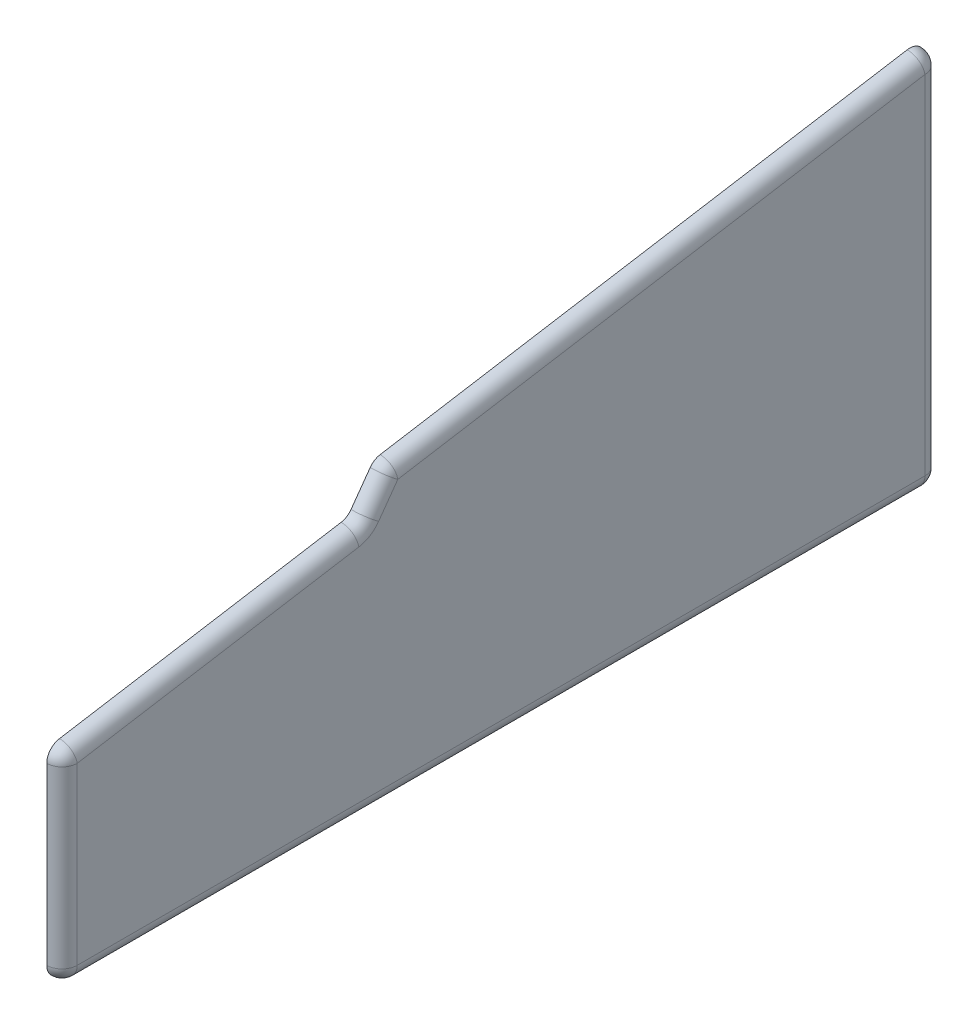
from build123d import *

# Parameters (mm, degrees)
BOSS_EXTRUDE1_DEPTH = 2
BOSS_EXTRUDE2_DEPTH = 3
FILLET1_R           = 3


with BuildPart() as part:
    # Sketch1 → Boss-Extrude1 (new body)
    with BuildSketch(Plane.ZY.offset(329.974562358)):
        with BuildLine():
            Line((137.105001839, 14.690261729), (137.105001839, -0.019509128))
            Line((137.105001839, -0.019509128), (133.705001839, -0.019509128))
            Line((133.705001839, -0.019509128), (129.505001839, -0.019509128))
            Line((129.505001839, -0.019509128), (129.505001839, -17.019509128))
            Line((129.505001839, -17.019509128), (-21.848970599, -17.019509128))
            Line((-21.848970599, -17.019509128), (-21.848970599, -0.019509128))
            Line((-21.848970599, -0.019509128), (-26.048970599, -0.019509128))
            Line((-26.048970599, -0.019509128), (-29.448970599, -0.019509128))
            Line((-29.448970599, -0.019509128), (-29.448970599, 47.708117707))
            ThreePointArc((-29.448970599, 47.708117707), (-28.460366767, 49.843262649), (-26.192653512, 50.470684397))
            Line((-26.192653512, 50.470684397), (74.05116687, 33.912543624))
            Line((74.05116687, 33.912543624), (79.277875997, 26.617509644))
            Line((79.277875997, 26.617509644), (134.761318926, 17.452828418))
            ThreePointArc((134.761318926, 17.452828418), (136.440146781, 16.501657897), (137.105001839, 14.690261729))
        make_face()
    extrude(amount=-BOSS_EXTRUDE1_DEPTH)

    # Sketch1<4> → Boss-Extrude2 (add)
    with BuildSketch(Plane.ZY.offset(329.974562358)):
        with BuildLine():
            Line((140.305001839, -17.219509128), (140.305001839, 17.2353763))
            ThreePointArc((140.305001839, 17.2353763), (139.592657134, 19.176157909), (137.793913004, 20.195269182))
            Line((137.793913004, 20.195269182), (82.333171975, 29.356200538))
            ThreePointArc((82.333171975, 29.356200538), (81.237686153, 29.768607171), (80.383410411, 30.568845492))
            Line((80.383410411, 30.568845492), (76.604168861, 35.843616835))
            ThreePointArc((76.604168861, 35.843616835), (75.749893119, 36.643855156), (74.654407298, 37.056261789))
            Line((74.654407298, 37.056261789), (-29.160059434, 54.204197172))
            ThreePointArc((-29.160059434, 54.204197172), (-31.589752208, 53.531959584), (-32.648970599, 51.24430429))
            Line((-32.648970599, 51.24430429), (-32.648970599, -17.219509128))
            ThreePointArc((-32.648970599, -17.219509128), (-31.770290943, -19.340829471), (-29.648970599, -20.219509128))
            Line((-29.648970599, -20.219509128), (137.305001839, -20.219509128))
            ThreePointArc((137.305001839, -20.219509128), (139.426322182, -19.340829471), (140.305001839, -17.219509128))
        make_face()
    extrude(amount=BOSS_EXTRUDE2_DEPTH)

    # Fillet1
    fillet1_edges = [part.edges().sort_by_distance(p)[0] for p in [
        (-332.974562358, 17.012397581, -32.648970599),
        (-332.974562358, 53.531959584, -31.589752208),
        (-332.974562358, 45.63022948, 22.747173932),
        (-332.974562358, 36.643855156, 75.749893119),
        (-332.974562358, 33.206231163, 78.493789636),
        (-332.974562358, 29.768607171, 81.237686153),
        (-332.974562358, 24.77573486, 110.063542489),
        (-332.974562358, 19.176157909, 139.592657134),
        (-332.974562358, 0.007933586, 140.305001839),
        (-332.974562358, -19.340829471, 139.426322182),
        (-332.974562358, -20.219509128, 53.82801562),
        (-332.974562358, -19.340829471, -31.770290943),
    ]]
    fillet(fillet1_edges, radius=FILLET1_R - 0.0001)  # a hair under: the kernel refuses the full size


with BuildPart() as body_2:
    # Mirror1: mirrored copy
    add(part.part.mirror(Plane.ZY.offset(327.974562358)))


solid = body_2.part
